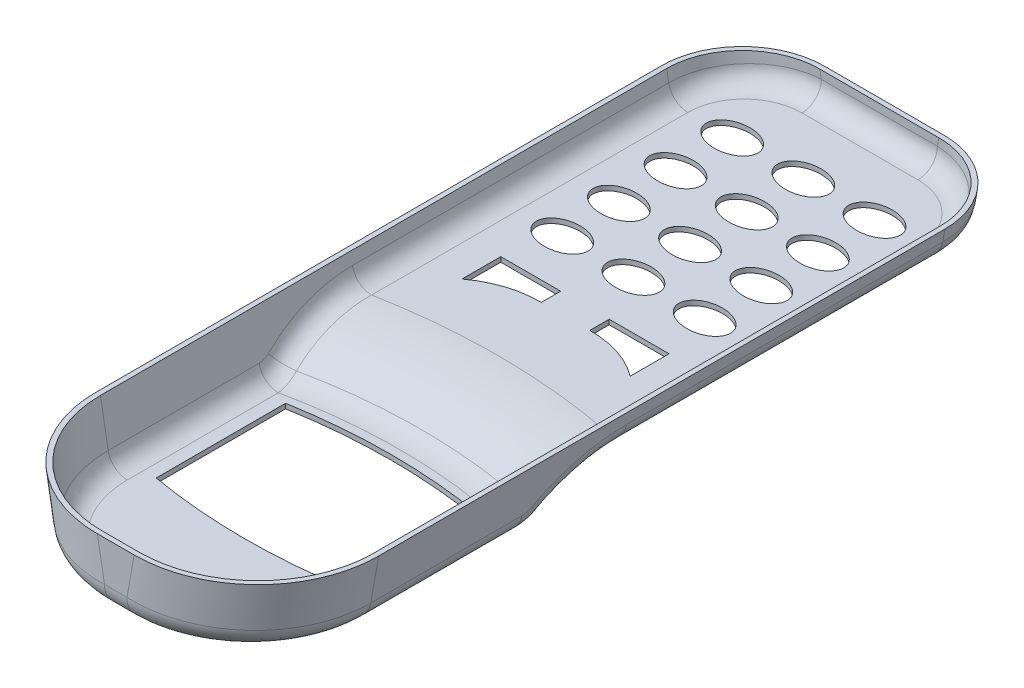
from build123d import *

# Parameters (mm, degrees)
SKETCH_1_W          = 17.5
SKETCH_1_H          = 47.5
EXTRUDE_1_DEPTH     = 2
EXTRUDE_2_DEPTH     = 2
CUT_EXTRUDE_1_DEPTH = 49.340588536
FILLET_1_R          = 7.5
FILLET_2_R          = 5
FILLET_3_R          = 2.5
FILLET_4_R          = 7.7
FILLET_5_R          = 1.5
SHELL_1_T           = -0.3
CUT_EXTRUDE_2_DEPTH = 49.464549024
SKETCH_5_RX         = 1.6
SKETCH_5_RY         = 1.1
CUT_EXTRUDE_3_DEPTH = 49.340588656


with BuildPart() as part:
    # 스케치1 → 보스-돌출1 (new body)
    with BuildSketch(Plane(origin=(0, 0, 0), x_dir=(1, 0, 0), z_dir=(0, 1, 0))):
        with Locations((0, 23.75)):
            Rectangle(SKETCH_1_W, SKETCH_1_H)
    extrude(amount=EXTRUDE_1_DEPTH)

    # 스케치2 → 보스-돌출2 (add)
    with BuildSketch(Plane.XZ):
        with BuildLine():
            Line((-8.75, 0), (8.75, 0))
            Line((8.75, 0), (8.75, -18.888604279))
            ThreePointArc((8.75, -18.888604279), (0, -20), (-8.75, -18.888604279))
            Line((-8.75, -18.888604279), (-8.75, 0))
        make_face()
    extrude(amount=EXTRUDE_2_DEPTH)

    # 스케치3 → 컷-돌출1 (cut, through all)
    with BuildSketch(Plane(origin=(0, 0, -47.5), x_dir=(-1, 0, 0), z_dir=(0, 0, -1))):
        Polygon((-8.75, 2), (-8.044692077, -2), (-8.75, -2), align=None)
        Polygon((8.75, -2), (8.75, 2), (8.044692077, -2), align=None)
    extrude(amount=-CUT_EXTRUDE_1_DEPTH, mode=Mode.SUBTRACT)

    # 필렛1
    fillet_1_edges = [part.edges().sort_by_distance(p)[0] for p in [
        (8.397346039, 0, 0),
        (-8.397346039, 0, 0),
    ]]
    fillet(fillet_1_edges, radius=FILLET_1_R)

    # 필렛2
    fillet_2_edges = [part.edges().sort_by_distance(p)[0] for p in [
        (8.573673019, 1, -47.5),
        (-8.573673019, 1, -47.5),
    ]]
    fillet(fillet_2_edges, radius=FILLET_2_R)

    # 필렛3
    # the kernel refuses this fillet: 2.5 mm, written as the material it takes off along each edge
    with BuildSketch(Plane(origin=(0, -2, 15), x_dir=(0.3957565670683907, 0, -0.9183554538533771), z_dir=(0.9183554538533771, 0, 0.3957565670683907))) as fillet_3_piece_1:
        with BuildLine():
            CenterArc((32.550510257, 2.5), FILLET_3_R, 270, 78.463040967)
            Line((35, 2), (35.048989795, 1.99))
            ThreePointArc((35.048989795, 1.99), (35.05, 1), (35.05, 0))
            Line((35.05, 0), (35, -0.05))
            Line((35, -0.05), (32.550510257, -0.05))
            Line((32.550510257, -0.05), (32.550510257, 0))
        make_face()
    revolve(axis=Axis((0, -2, 15), (0, 1, 0)), revolution_arc=46.626335133, mode=Mode.SUBTRACT)

    # 필렛4
    fillet_4_edges = [part.edges().sort_by_distance(p)[0] for p in [
        (0, 0, -20),
    ]]
    fillet(fillet_4_edges, radius=FILLET_4_R)

    # 필렛5
    fillet_5_edges = [part.edges().sort_by_distance(p)[0] for p in [
        (0, -2, 0),
        (8.044692077, -2, -12.020372914),
        (-8.044692077, -2, -12.020372914),
        (-5.793457794, -2, -2.176442973),
        (5.793457794, -2, -2.176442973),
        (8.397346039, 0, -32.596370073),
        (0, 0, -47.5),
        (-6.896523183, 0, -46.049038018),
        (6.896523183, 0, -46.049038018),
        (8.066546705, -1.876056247, -17.336986268),
        (-8.066546705, -1.876056247, -17.336986268),
        (-8.397346039, 0, -32.596370074),
        (8.329785544, -0.383154606, -20.247213146),
        (-8.329785544, -0.383154605, -20.247213147),
    ]]
    fillet(fillet_5_edges, radius=FILLET_5_R)

    # 쉘1
    shell_1_openings = [part.faces().sort_by_distance(p)[0] for p in [
        (0, 2, -24.120128989),
    ]]
    offset(amount=SHELL_1_T, openings=shell_1_openings, kind=Kind.INTERSECTION)

    # 스케치4 → 컷-돌출2 (cut, through all)
    with BuildSketch(Plane.XZ.offset(2)):
        with BuildLine():
            Line((-6, -8.5), (-6, -16.5))
            ThreePointArc((-6, -16.5), (0, -17.018120701), (6, -16.5))
            Line((6, -16.5), (6, -8.5))
            ThreePointArc((6, -8.5), (0, -7.981879299), (-6, -8.5))
        make_face()
    extrude(amount=-CUT_EXTRUDE_2_DEPTH, mode=Mode.SUBTRACT)

    # 스케치5 → 컷-돌출3 (cut, through all)
    with BuildSketch(Plane.XZ):
        with Locations(Location((0, -42.5), (0, 0, -180))):
            Ellipse(SKETCH_5_RX, SKETCH_5_RY)
        with Locations((4.4, -42.5)):
            Ellipse(SKETCH_5_RX, SKETCH_5_RY)
        with Locations((-4.4, -42.5)):
            Ellipse(SKETCH_5_RX, SKETCH_5_RY)
        with Locations(Location((0, -39), (0, 0, -180))):
            Ellipse(SKETCH_5_RX, SKETCH_5_RY)
        with Locations((4.4, -39)):
            Ellipse(SKETCH_5_RX, SKETCH_5_RY)
        with Locations((-4.4, -39)):
            Ellipse(SKETCH_5_RX, SKETCH_5_RY)
        with Locations(Location((0, -35.5), (0, 0, -180))):
            Ellipse(SKETCH_5_RX, SKETCH_5_RY)
        with Locations((4.4, -35.5)):
            Ellipse(SKETCH_5_RX, SKETCH_5_RY)
        with Locations((-4.4, -35.5)):
            Ellipse(SKETCH_5_RX, SKETCH_5_RY)
        with Locations(Location((0, -32), (0, 0, -180))):
            Ellipse(SKETCH_5_RX, SKETCH_5_RY)
        with Locations(Location((4.4, -32), (0, 0, -180))):
            Ellipse(SKETCH_5_RX, SKETCH_5_RY)
        with Locations(Location((-4.4, -32), (0, 0, 180))):
            Ellipse(SKETCH_5_RX, SKETCH_5_RY)
        with BuildLine():
            Line((-5.2, -26.6), (-5.2, -29))
            Line((-5.2, -29), (-1.5, -29))
            Line((-1.5, -29), (-1.5, -27.8))
            ThreePointArc((-1.5, -27.8), (-3.449941282, -27.508152286), (-5.2, -26.6))
        make_face()
        with BuildLine():
            Line((1.5, -29), (1.5, -27.8))
            ThreePointArc((1.5, -27.8), (3.449941282, -27.508152286), (5.2, -26.6))
            Line((5.2, -26.6), (5.2, -29))
            Line((5.2, -29), (1.5, -29))
        make_face()
    extrude(amount=-CUT_EXTRUDE_3_DEPTH, mode=Mode.SUBTRACT)


solid = part.part
